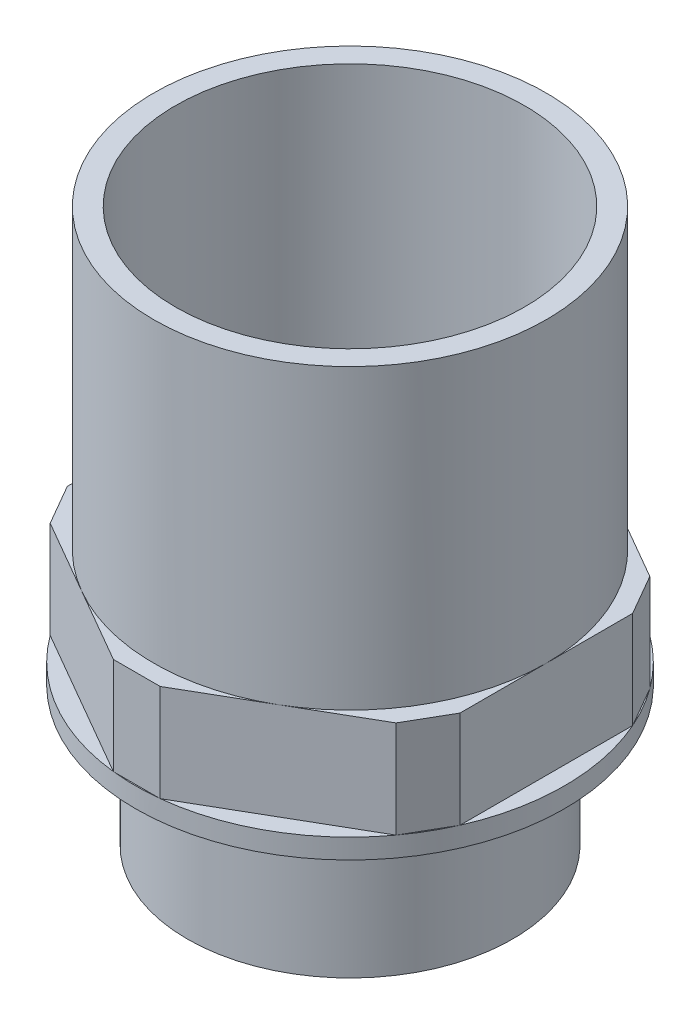
from build123d import *

# Parameters (mm, degrees)
SKETCH2_R           = 20.828
BASE_EXTRUDE_DEPTH  = 17.78
SKETCH3_R           = 27.4701
BOSS_EXTRUDE1_DEPTH = 2.54
BOSS_EXTRUDE3_DEPTH = 12.446
SKETCH6_R           = 25.146
BOSS_EXTRUDE4_DEPTH = 38.1
SKETCH7_R           = 22.352
CUT_EXTRUDE1_DEPTH  = 50.546
SKETCH8_R           = 17.145
CUT_EXTRUDE2_DEPTH  = 81.815857009


with BuildPart() as part:
    # Sketch2 → Base-Extrude (new body)
    with BuildSketch(Plane(origin=(0, 0, 0), x_dir=(1, 0, 0), z_dir=(0, 1, 0))):
        Circle(SKETCH2_R)
    extrude(amount=BASE_EXTRUDE_DEPTH)

    # Sketch3 → Boss-Extrude1 (add)
    with BuildSketch(Plane(origin=(0, 17.78, 0), x_dir=(-1, 0, 0), z_dir=(0, 1, 0))):
        Circle(SKETCH3_R)
    extrude(amount=BOSS_EXTRUDE1_DEPTH)

    # Sketch5 → Boss-Extrude3 (add)
    with BuildSketch(Plane(origin=(0, 20.32, 0), x_dir=(-1, 0, 0), z_dir=(0, 1, 0))):
        Polygon((25.146, -11.058258362), (25.146, 11.058258362), (22.149732663, 16.247945622), (2.996267337, 27.306203985), (-2.996267337, 27.306203985), (-22.149732663, 16.247945622), (-25.146, 11.058258362), (-25.146, -11.058258362), (-22.149732663, -16.247945622), (-2.996267337, -27.306203985), (2.996267337, -27.306203985), (22.149732663, -16.247945622), align=None)
    extrude(amount=BOSS_EXTRUDE3_DEPTH)

    # Sketch6 → Boss-Extrude4 (add)
    with BuildSketch(Plane(origin=(0, 32.766, 0), x_dir=(-1, 0, 0), z_dir=(0, 1, 0))):
        Circle(SKETCH6_R)
    extrude(amount=BOSS_EXTRUDE4_DEPTH)

    # Sketch7 → Cut-Extrude1 (cut)
    with BuildSketch(Plane(origin=(0, 70.866, 0), x_dir=(-1, 0, 0), z_dir=(0, 1, 0))):
        Circle(SKETCH7_R)
    extrude(amount=-CUT_EXTRUDE1_DEPTH, mode=Mode.SUBTRACT)

    # Sketch8 → Cut-Extrude2 (cut, through all)
    with BuildSketch(Plane.XZ):
        Circle(SKETCH8_R)
    extrude(amount=-CUT_EXTRUDE2_DEPTH, mode=Mode.SUBTRACT)


solid = part.part
